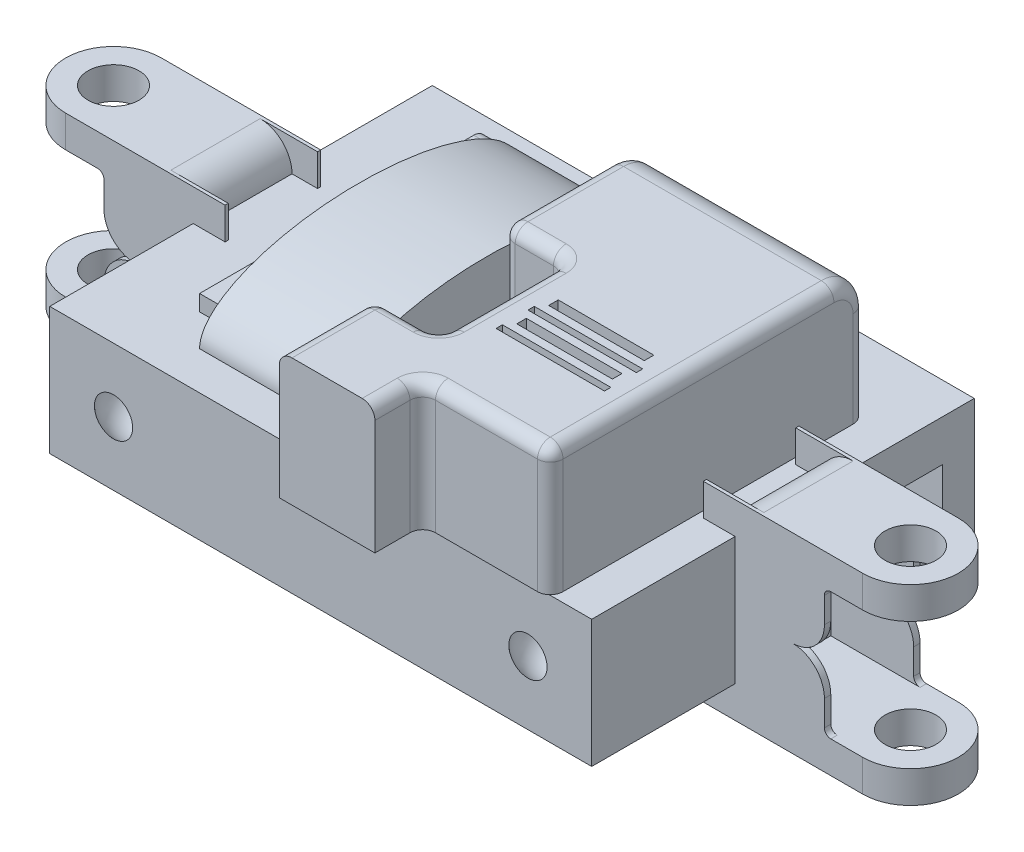
from build123d import *

# Parameters (mm, degrees)
SKETCH1_W                = 85
SKETCH1_H                = 60
BOSS_EXTRUDE1_DEPTH      = 20
BOSS_EXTRUDE4_DEPTH      = 5
SKETCH4_W                = 4
SKETCH4_H                = 14
CUT_EXTRUDE2_DEPTH       = 5
FILLET1_R                = 5
SKETCH5_W                = 14
SKETCH5_H                = 10
BOSS_EXTRUDE6_DEPTH      = 7.5
SKETCH7_W                = 12
SKETCH7_H                = 13
CUT_EXTRUDE5_DEPTH       = 10
SKETCH8_W                = 13
SKETCH8_H                = 10
CUT_EXTRUDE6_DEPTH       = 10
FILLET4_R                = 5
FILLET5_R                = 1
SKETCH9_R                = 4
CUT_EXTRUDE7_DEPTH       = 10
BOSS_EXTRUDE7_DEPTH      = 20
FILLET6_R                = 5
FILLET7_START            = 20
FILLET7_DEPTH            = 21
FILLET7_2_DEPTH          = 20
FILLET8_R                = 2
CIRPATTERN1_COUNT        = 2
FILLET1_OF_CIRPATTERN1_R = 5
FILLET4_OF_CIRPATTERN1_R = 5
FILLET5_OF_CIRPATTERN1_R = 1
CIRPATTERN5_START        = -7.5
CIRPATTERN5_DEPTH        = 1
CIRPATTERN5_START_2      = 6.5
CIRPATTERN5_2_DEPTH      = 1
CIRPATTERN5_START_3      = -5
CIRPATTERN5_3_OUTLINE_R  = 4
CIRPATTERN5_3_DEPTH      = 5
CIRPATTERN5_4_OUTLINE_W  = 1
CIRPATTERN5_4_OUTLINE_H  = 15
CIRPATTERN5_4_DEPTH      = 10
CIRPATTERN5_START_4      = -7
CIRPATTERN5_5_DEPTH      = 14
CIRPATTERN5_6_DEPTH      = 14
MIRROR1_START            = -7.5
MIRROR1_DEPTH            = 1
MIRROR1_START_2          = 6.5
MIRROR1_2_DEPTH          = 1
MIRROR1_START_3          = -5
MIRROR1_3_OUTLINE_R      = 4
MIRROR1_3_DEPTH          = 5
MIRROR1_4_OUTLINE_W      = 1
MIRROR1_4_OUTLINE_H      = 15
MIRROR1_4_DEPTH          = 10
MIRROR1_START_4          = -7
MIRROR1_5_DEPTH          = 14
MIRROR1_6_DEPTH          = 14
SKETCH16_W               = 17
SKETCH16_H               = 1
CUT_EXTRUDE9_DEPTH       = 5
BOSS_EXTRUDE8_DEPTH      = 20
BOSS_EXTRUDE9_DEPTH      = 5
SKETCH25_W               = 9
SKETCH25_H               = 7
CUT_EXTRUDE10_DEPTH      = 126.300638466
SKETCH11_W               = 15
SKETCH11_H               = 1.5
CUT_EXTRUDE8_DEPTH       = 20
SKETCH26_W               = 10
SKETCH26_H               = 9
CUT_EXTRUDE11_DEPTH      = 127.199247224


with BuildPart() as part:
    # Sketch1 → Boss-Extrude1 (new body)
    with BuildSketch(Plane(origin=(0, 0, 0), x_dir=(1, 0, 0), z_dir=(0, 1, 0))):
        Rectangle(SKETCH1_W, SKETCH1_H)
    extrude(amount=BOSS_EXTRUDE1_DEPTH)

    # Sketch2 → Boss-Extrude4 (add)
    with BuildSketch(Plane(origin=(0, 20, 0), x_dir=(1, 0, 0), z_dir=(0, 1, 0))):
        with BuildLine():
            Line((-37.5, 7.5), (-62.5, 7.5))
            ThreePointArc((-62.5, 7.5), (-70, 0), (-62.5, -7.5))
            Line((-62.5, -7.5), (-37.5, -7.5))
            Line((-37.5, -7.5), (-37.5, 7.5))
        make_face()
    boss_extrude4 = extrude(amount=BOSS_EXTRUDE4_DEPTH)

    # Sketch4 → Cut-Extrude2 (cut)
    with BuildSketch(Plane(origin=(0, 25, 0), x_dir=(1, 0, 0), z_dir=(0, 1, 0))):
        with Locations((-39.5, 0)):
            Rectangle(SKETCH4_W, SKETCH4_H)
    cut_extrude2 = extrude(amount=-CUT_EXTRUDE2_DEPTH, mode=Mode.SUBTRACT)

    # Fillet1
    fillet1_edges = [part.edges().sort_by_distance(p)[0] for p in [
        (-41.5, 25, 0),
    ]]
    fillet(fillet1_edges, radius=FILLET1_R - 0.0001)  # a hair under: the kernel refuses the full size

    # Sketch5 → Boss-Extrude6 (add, symmetric)
    with BuildSketch(Plane.XY):
        with Locations((-49.5, 15)):
            Rectangle(SKETCH5_W, SKETCH5_H)
    boss_extrude6 = extrude(amount=BOSS_EXTRUDE6_DEPTH, both=True)

    # Sketch7 → Cut-Extrude5 (cut)
    with BuildSketch(Plane.XZ.offset(-10)):
        with Locations((-49.5, 0)):
            Rectangle(SKETCH7_W, SKETCH7_H)
    cut_extrude5 = extrude(amount=-CUT_EXTRUDE5_DEPTH, mode=Mode.SUBTRACT)

    # Sketch8 → Cut-Extrude6 (cut)
    with BuildSketch(Plane(origin=(-55.5, 0, 0), x_dir=(0, 0, -1), z_dir=(1, 0, 0))):
        with Locations((0, 15)):
            Rectangle(SKETCH8_W, SKETCH8_H)
    cut_extrude6 = extrude(amount=-CUT_EXTRUDE6_DEPTH, mode=Mode.SUBTRACT)

    # Fillet4
    fillet4_edges = [part.edges().sort_by_distance(p)[0] for p in [
        (-56.5, 10, -7),
        (-56.5, 10, 7),
    ]]
    fillet(fillet4_edges, radius=FILLET4_R)

    # Fillet5
    fillet5_edges = [part.edges().sort_by_distance(p)[0] for p in [
        (-56.5, 20, -7),
        (-56.5, 20, 7),
    ]]
    fillet(fillet5_edges, radius=FILLET5_R)

    # Sketch9 → Cut-Extrude7 (cut)
    with BuildSketch(Plane(origin=(0, 25, 0), x_dir=(1, 0, 0), z_dir=(0, 1, 0))):
        with Locations(Location((-62.5, 0, 0), (0, 0, 270))):
            Circle(SKETCH9_R)
    cut_extrude7 = extrude(amount=-CUT_EXTRUDE7_DEPTH, mode=Mode.SUBTRACT)

    # Sketch10 → Boss-Extrude7 (add)
    with BuildSketch(Plane(origin=(0, 20, 0), x_dir=(1, 0, 0), z_dir=(0, 1, 0))):
        Polygon((1.5, -3), (11.5, -3), (11.5, -23), (1.5, -23), (1.5, -38), (16.5, -38), (16.5, -30.5), (36.5, -30.5), (36.5, 0.746164075), (36.5, 19), (1.5, 19), align=None)
    extrude(amount=BOSS_EXTRUDE7_DEPTH)

    # Fillet6
    fillet6_edges = [part.edges().sort_by_distance(p)[0] for p in [
        (19, 40, -19),
    ]]
    fillet(fillet6_edges, radius=FILLET6_R)

    # Fillet7: read off the stored shape, not the designer's step
    # Fillet7 outline → Fillet7 (cut)
    with BuildSketch(Plane(origin=(0, 0, 0), x_dir=(1, 0, 0), z_dir=(0, 1, 0)).offset(FILLET7_START)):
        with BuildLine():
            Line((36.5, -30.5), (36.5, -28.5))
            ThreePointArc((36.5, -28.5), (35.914213562, -29.914213562), (34.5, -30.5))
            Line((34.5, -30.5), (36.5, -30.5))
        make_face()
        with BuildLine():
            Line((1.5, -23), (1.5, -25))
            ThreePointArc((1.5, -25), (2.085786438, -23.585786438), (3.5, -23))
            Line((3.5, -23), (1.5, -23))
        make_face()
        with BuildLine():
            Line((1.5, -3), (3.5, -3))
            ThreePointArc((3.5, -3), (2.085786438, -2.414213562), (1.5, -1))
            Line((1.5, -1), (1.5, -3))
        make_face()
    extrude(amount=FILLET7_DEPTH, mode=Mode.SUBTRACT)

    # Fillet7 2 outline → Fillet7 2 (add)
    with BuildSketch(Plane(origin=(0, 0, 0), x_dir=(1, 0, 0), z_dir=(0, 1, 0)).offset(FILLET7_START)):
        with BuildLine():
            ThreePointArc((16.5, -32.5), (17.085786438, -31.085786438), (18.5, -30.5))
            Line((18.5, -30.5), (16.5, -30.5))
            Line((16.5, -30.5), (16.5, -32.5))
        make_face()
        with BuildLine():
            ThreePointArc((9.5, -3), (10.914213562, -3.585786438), (11.5, -5))
            Line((11.5, -5), (11.5, -3))
            Line((11.5, -3), (9.5, -3))
        make_face()
        with BuildLine():
            ThreePointArc((11.5, -21), (10.914213562, -22.414213562), (9.5, -23))
            Line((9.5, -23), (11.5, -23))
            Line((11.5, -23), (11.5, -21))
        make_face()
    extrude(amount=FILLET7_2_DEPTH)

    # Fillet8
    fillet8_edges = [part.edges().sort_by_distance(p)[0] for p in [
        (16.5, 40, 35.25),
        (1.5, 40, -6.5),
        (1.5, 27.5, -19),
        (1.5, 38.535533906, -17.535533906),
        (36.5, 27.5, -19),
        (36.5, 38.535533906, -17.535533906),
        (36.5, 40, 7.25),
        (26.5, 40, 30.5),
        (6.5, 40, 3),
        (11.5, 40, 13),
        (6.5, 40, 23),
        (1.5, 40, 31.5),
        (2.085786438, 40, 2.414213562),
        (2.085786438, 40, 23.585786438),
        (35.914213562, 40, 29.914213562),
        (17.085786438, 40, 31.085786438),
        (10.914213562, 40, 22.414213562),
        (10.914213562, 40, 3.585786438),
    ]]
    fillet(fillet8_edges, radius=FILLET8_R)

    # CirPattern1: Boss-Extrude4, Cut-Extrude2, Boss-Extrude6, Cut-Extrude5, Cut-Extrude6, Cut-Extrude7 ×2 about axis
    cirpattern1_axis = Axis((0, 0, 0), (0, 1, 0))
    add([boss_extrude4.rotate(cirpattern1_axis, i * 360 / CIRPATTERN1_COUNT) for i in range(1, CIRPATTERN1_COUNT)])
    add([cut_extrude2.rotate(cirpattern1_axis, i * 360 / CIRPATTERN1_COUNT) for i in range(1, CIRPATTERN1_COUNT)], mode=Mode.SUBTRACT)
    add([boss_extrude6.rotate(cirpattern1_axis, i * 360 / CIRPATTERN1_COUNT) for i in range(1, CIRPATTERN1_COUNT)])
    add([cut_extrude5.rotate(cirpattern1_axis, i * 360 / CIRPATTERN1_COUNT) for i in range(1, CIRPATTERN1_COUNT)], mode=Mode.SUBTRACT)
    add([cut_extrude6.rotate(cirpattern1_axis, i * 360 / CIRPATTERN1_COUNT) for i in range(1, CIRPATTERN1_COUNT)], mode=Mode.SUBTRACT)
    add([cut_extrude7.rotate(cirpattern1_axis, i * 360 / CIRPATTERN1_COUNT) for i in range(1, CIRPATTERN1_COUNT)], mode=Mode.SUBTRACT)

    # Fillet1 of CirPattern1
    fillet1_of_cirpattern1_edges = [part.edges().sort_by_distance(p)[0] for p in [
        (41.5, 25, 0),
    ]]
    fillet(fillet1_of_cirpattern1_edges, radius=FILLET1_OF_CIRPATTERN1_R - 0.0001)  # a hair under: the kernel refuses the full size

    # Fillet4 of CirPattern1
    fillet4_of_cirpattern1_edges = [part.edges().sort_by_distance(p)[0] for p in [
        (56.5, 10, 7),
        (56.5, 10, -7),
    ]]
    fillet(fillet4_of_cirpattern1_edges, radius=FILLET4_OF_CIRPATTERN1_R)

    # Fillet5 of CirPattern1
    fillet5_of_cirpattern1_edges = [part.edges().sort_by_distance(p)[0] for p in [
        (56.5, 20, 7),
        (56.5, 20, -7),
    ]]
    fillet(fillet5_of_cirpattern1_edges, radius=FILLET5_OF_CIRPATTERN1_R)

    # CirPattern5: read off the stored shape, not the designer's step
    # CirPattern5 outline → CirPattern5 (add)
    with BuildSketch(Plane.XY.offset(CIRPATTERN5_START)):
        with BuildLine():
            ThreePointArc((57.5, 0), (56.792893219, 0.292893219), (56.5, 1))
            Line((56.5, 1), (56.5, 5))
            ThreePointArc((56.5, 5), (55.035533906, 8.535533906), (51.5, 10))
            Line((51.5, 10), (43.5, 10))
            Line((43.5, 10), (43.5, 0))
            Line((43.5, 0), (57.5, 0))
        make_face()
    extrude(amount=CIRPATTERN5_DEPTH)

    # CirPattern5 2 outline → CirPattern5 2 (add)
    with BuildSketch(Plane.XY.offset(CIRPATTERN5_START_2)):
        with BuildLine():
            ThreePointArc((57.5, 0), (56.792893219, 0.292893219), (56.5, 1))
            Line((56.5, 1), (56.5, 5))
            ThreePointArc((56.5, 5), (55.035533906, 8.535533906), (51.5, 10))
            Line((51.5, 10), (43.5, 10))
            Line((43.5, 10), (43.5, 0))
            Line((43.5, 0), (57.5, 0))
        make_face()
    extrude(amount=CIRPATTERN5_2_DEPTH)

    # CirPattern5 3 outline → CirPattern5 3 (add)
    with BuildSketch(Plane(origin=(0, 0, 0), x_dir=(1, 0, 0), z_dir=(0, 1, 0)).offset(CIRPATTERN5_START_3)):
        with BuildLine():
            Line((37.5, 7.5), (37.5, 7))
            Line((37.5, 7), (42.5, 7))
            Line((42.5, 7), (42.5, -7))
            Line((42.5, -7), (37.5, -7))
            Line((37.5, -7), (37.5, -7.5))
            Line((37.5, -7.5), (62.5, -7.5))
            ThreePointArc((62.5, -7.5), (70, 0), (62.5, 7.5))
            Line((62.5, 7.5), (37.5, 7.5))
        make_face()
        with Locations((62.5, 0)):
            Circle(CIRPATTERN5_3_OUTLINE_R, mode=Mode.SUBTRACT)
    extrude(amount=CIRPATTERN5_3_DEPTH)

    # CirPattern5 4 outline → CirPattern5 4 (add)
    with BuildSketch(Plane(origin=(0, 0, 0), x_dir=(1, 0, 0), z_dir=(0, 1, 0))):
        with Locations((43, 0)):
            Rectangle(CIRPATTERN5_4_OUTLINE_W, CIRPATTERN5_4_OUTLINE_H)
    extrude(amount=CIRPATTERN5_4_DEPTH)

    # CirPattern5 5 outline → CirPattern5 5 (cut)
    with BuildSketch(Plane.XY.offset(CIRPATTERN5_START_4)):
        with BuildLine():
            Line((42.5, -5), (46.5, -5))
            ThreePointArc((46.5, -5), (44.263932023, -4.472135955), (42.5, -3))
            Line((42.5, -3), (42.5, -5))
        make_face()
    extrude(amount=CIRPATTERN5_5_DEPTH, mode=Mode.SUBTRACT)

    # CirPattern5 6 outline → CirPattern5 6 (add)
    with BuildSketch(Plane.XY.offset(CIRPATTERN5_START_4)):
        with BuildLine():
            ThreePointArc((41.5, 0), (41.75658351, -1.58113883), (42.5, -3))
            Line((42.5, -3), (42.5, 0))
            Line((42.5, 0), (41.5, 0))
        make_face()
    extrude(amount=CIRPATTERN5_6_DEPTH)

    # Mirror1: read off the stored shape, not the designer's step
    # Mirror1 outline → Mirror1 (add)
    with BuildSketch(Plane.XY.offset(MIRROR1_START)):
        with BuildLine():
            Line((-56.5, 5), (-56.5, 1))
            ThreePointArc((-56.5, 1), (-56.792893219, 0.292893219), (-57.5, 0))
            Line((-57.5, 0), (-43.5, 0))
            Line((-43.5, 0), (-43.5, 10))
            Line((-43.5, 10), (-51.5, 10))
            ThreePointArc((-51.5, 10), (-55.035533906, 8.535533906), (-56.5, 5))
        make_face()
    extrude(amount=MIRROR1_DEPTH)

    # Mirror1 2 outline → Mirror1 2 (add)
    with BuildSketch(Plane.XY.offset(MIRROR1_START_2)):
        with BuildLine():
            Line((-56.5, 5), (-56.5, 1))
            ThreePointArc((-56.5, 1), (-56.792893219, 0.292893219), (-57.5, 0))
            Line((-57.5, 0), (-43.5, 0))
            Line((-43.5, 0), (-43.5, 10))
            Line((-43.5, 10), (-51.5, 10))
            ThreePointArc((-51.5, 10), (-55.035533906, 8.535533906), (-56.5, 5))
        make_face()
    extrude(amount=MIRROR1_2_DEPTH)

    # Mirror1 3 outline → Mirror1 3 (add)
    with BuildSketch(Plane(origin=(0, 0, 0), x_dir=(1, 0, 0), z_dir=(0, 1, 0)).offset(MIRROR1_START_3)):
        with BuildLine():
            Line((-37.5, -7.5), (-37.5, -7))
            Line((-37.5, -7), (-42.5, -7))
            Line((-42.5, -7), (-42.5, 7))
            Line((-42.5, 7), (-37.5, 7))
            Line((-37.5, 7), (-37.5, 7.5))
            Line((-37.5, 7.5), (-62.5, 7.5))
            ThreePointArc((-62.5, 7.5), (-70, 0), (-62.5, -7.5))
            Line((-62.5, -7.5), (-37.5, -7.5))
        make_face()
        with Locations((-62.5, 0)):
            Circle(MIRROR1_3_OUTLINE_R, mode=Mode.SUBTRACT)
    extrude(amount=MIRROR1_3_DEPTH)

    # Mirror1 4 outline → Mirror1 4 (add)
    with BuildSketch(Plane(origin=(0, 0, 0), x_dir=(1, 0, 0), z_dir=(0, 1, 0))):
        with Locations((-43, 0)):
            Rectangle(MIRROR1_4_OUTLINE_W, MIRROR1_4_OUTLINE_H)
    extrude(amount=MIRROR1_4_DEPTH)

    # Mirror1 5 outline → Mirror1 5 (cut)
    with BuildSketch(Plane.XY.offset(MIRROR1_START_4)):
        with BuildLine():
            ThreePointArc((-42.5, -3), (-44.263932023, -4.472135955), (-46.5, -5))
            Line((-46.5, -5), (-42.5, -5))
            Line((-42.5, -5), (-42.5, -3))
        make_face()
    extrude(amount=MIRROR1_5_DEPTH, mode=Mode.SUBTRACT)

    # Mirror1 6 outline → Mirror1 6 (add)
    with BuildSketch(Plane.XY.offset(MIRROR1_START_4)):
        with BuildLine():
            Line((-42.5, 0), (-42.5, -3))
            ThreePointArc((-42.5, -3), (-41.75658351, -1.58113883), (-41.5, 0))
            Line((-41.5, 0), (-42.5, 0))
        make_face()
    extrude(amount=MIRROR1_6_DEPTH)

    # Sketch16 → Cut-Extrude9 (cut)
    with BuildSketch(Plane(origin=(0, 40, 0), x_dir=(1, 0, 0), z_dir=(0, 1, 0))):
        with Locations((24, -12.5)):
            Rectangle(SKETCH16_W, SKETCH16_H)
        with Locations((24, -17.5)):
            Rectangle(SKETCH16_W, SKETCH16_H)
    extrude(amount=-CUT_EXTRUDE9_DEPTH, mode=Mode.SUBTRACT)

    # Sketch17 → Boss-Extrude8 (add)
    with BuildSketch(Plane(origin=(-5, 0, 0), x_dir=(0, 0, -1), z_dir=(1, 0, 0))):
        with BuildLine():
            Line((26, 20), (-24, 20))
            add(Edge.make_bspline(
                [(26, 20), (26, 30), (1, 30), (-24, 30), (-24, 20)],
                knots=[3.141592654, 3.141592654, 3.141592654, 4.71238898, 4.71238898, 6.283185307, 6.283185307, 6.283185307], degree=2, weights=[1, 0.707106781, 1, 0.707106781, 1]))
        make_face()
    extrude(amount=-BOSS_EXTRUDE8_DEPTH)

    # Sketch18 → Boss-Extrude9 (add)
    with BuildSketch(Plane.ZY.offset(25)):
        with BuildLine():
            Line((-24, 22.5), (19, 22.5))
            Line((19, 22.5), (19, 20))
            Line((19, 20), (-26, 20))
            Line((-26, 20), (-26, 20.5))
            ThreePointArc((-26, 20.5), (-25.414213562, 21.914213562), (-24, 22.5))
        make_face()
    extrude(amount=BOSS_EXTRUDE9_DEPTH)

    # Sketch19 → Cut-Revolve2 (revolve, cut)
    with BuildSketch(Plane.XY.offset(26)):
        with BuildLine():
            Line((-32.5, 15), (-32.5, 5))
            ThreePointArc((-32.5, 5), (-27.5, 10), (-32.5, 15))
        make_face()
    cut_revolve2 = revolve(axis=Axis((-32.5, 15, 26), (0, -1, 0)), mode=Mode.SUBTRACT)

    # Mirror3: Cut-Revolve2 across plane
    add(cut_revolve2.mirror(Plane(origin=(0, 0, 0), x_dir=(0, 0, 1), z_dir=(1, 0, 0))), mode=Mode.SUBTRACT)

    # Sketch25 → Cut-Extrude10 (cut, through all)
    with BuildSketch(Plane.ZY.offset(42.5)):
        with Locations((-20.5, 10)):
            Rectangle(SKETCH25_W, SKETCH25_H)
    extrude(amount=-CUT_EXTRUDE10_DEPTH, mode=Mode.SUBTRACT)

    # Sketch11 → Cut-Extrude8 (cut)
    with BuildSketch(Plane(origin=(0, 40, 0), x_dir=(1, 0, 0), z_dir=(0, 1, 0))):
        with Locations((24, -15)):
            Rectangle(SKETCH11_W, SKETCH11_H)
        with Locations((24, -10)):
            Rectangle(SKETCH11_W, SKETCH11_H)
    extrude(amount=-CUT_EXTRUDE8_DEPTH, mode=Mode.SUBTRACT)

    # Sketch26 → Cut-Extrude11 (cut, through all)
    with BuildSketch(Plane.ZY.offset(43.5)):
        with Locations((0, 8.5)):
            Rectangle(SKETCH26_W, SKETCH26_H)
    extrude(amount=-CUT_EXTRUDE11_DEPTH, mode=Mode.SUBTRACT)


solid = part.part
